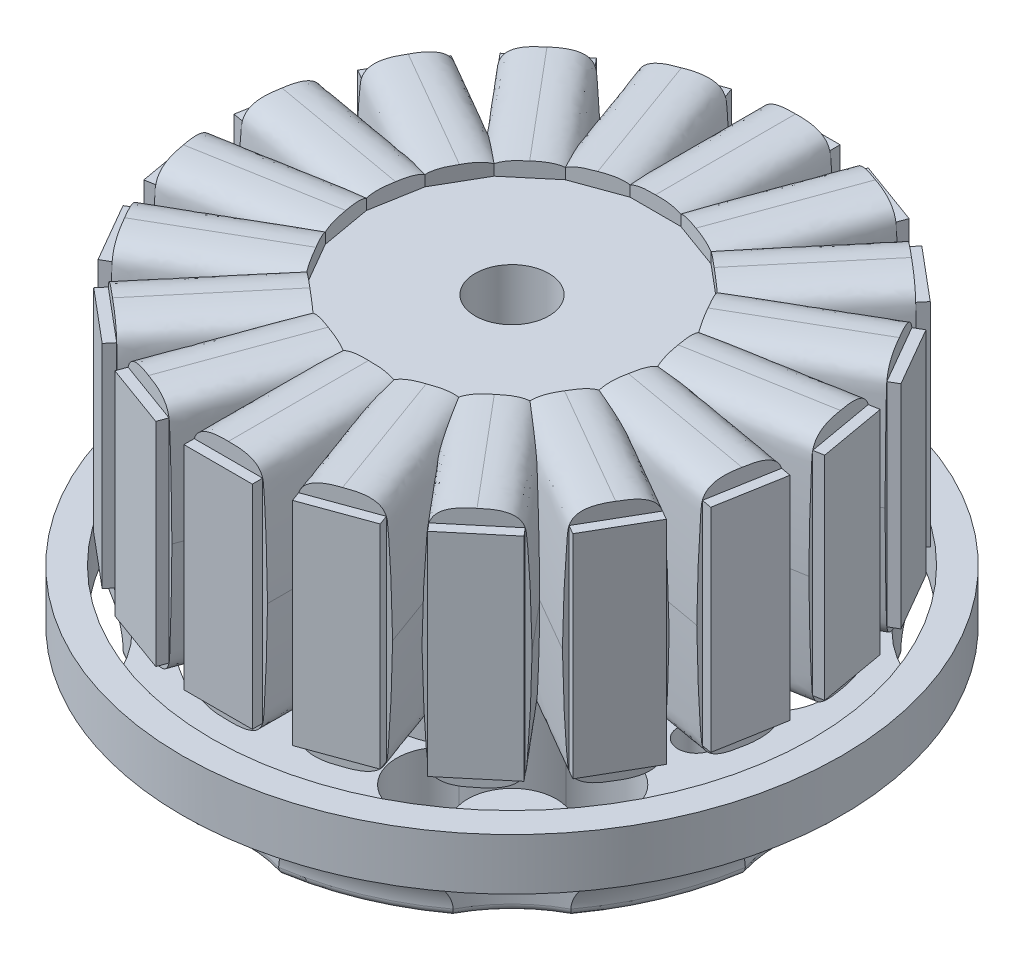
from build123d import *

# Parameters (mm, degrees)
SKETCH1_R           = 22.36
BOSS_EXTRUDE1_DEPTH = 7.5
SKETCH4_R           = 3.5
SKETCH6_R           = 20.36
CUT_EXTRUDE3_DEPTH  = 3.9
SKETCH7_R           = 10
BOSS_EXTRUDE2_DEPTH = 20.8
BOSS_EXTRUDE3_START = -15.4
BOSS_EXTRUDE3_DEPTH = 15.4
CIRPATTERN1_COUNT   = 18
SKETCH10_R          = 24.373241
CUT_EXTRUDE4_DEPTH  = 1
SKETCH11_R          = 8
CUT_EXTRUDE5_DEPTH  = 0.2
SKETCH12_R          = 3.75
SKETCH12_R_2        = 2.5
BOSS_EXTRUDE4_DEPTH = 0.2
CUT_EXTRUDE6_START  = -41.2
SKETCH13_R          = 2.5
CUT_EXTRUDE6_DEPTH  = 41.2
SKETCH14_R          = 1.25
SKETCH14_R_2        = 1
SKETCH14_R_3        = 9.637923
CUT_EXTRUDE7_DEPTH  = 4
CUT_EXTRUDE8_DEPTH  = 10
BOSS_EXTRUDE5_DEPTH = 9.5
CIRPATTERN4_COUNT   = 18
FILLET2_R           = 0.5


with BuildPart() as part:
    # Sketch1 → Boss-Extrude1 (new body)
    with BuildSketch(Plane(origin=(0, 0, 0), x_dir=(1, 0, 0), z_dir=(0, 1, 0))):
        with Locations(Location((0, 0, 0), (0, 0, 270))):
            Circle(SKETCH1_R)
    extrude(amount=-BOSS_EXTRUDE1_DEPTH)

    # Sketch4 → Cut-Revolve1 (revolve, cut)
    with BuildSketch(Plane.XY, mode=Mode.PRIVATE) as cut_revolve1_sk:
        with Locations((-22.36, -7)):
            Circle(SKETCH4_R)
    revolve(cut_revolve1_sk.sketch.rotate(Axis((0, 0, 0), (0, -1, 0)), 270), axis=Axis((0, 0, 0), (0, -1, 0)), mode=Mode.SUBTRACT)

    # Sketch6 → Cut-Extrude3 (cut)
    with BuildSketch(Plane(origin=(0, 0, 0), x_dir=(1, 0, 0), z_dir=(0, 1, 0))):
        with Locations(Location((0, 0, 0), (0, 0, 270))):
            Circle(SKETCH6_R)
    extrude(amount=-CUT_EXTRUDE3_DEPTH, mode=Mode.SUBTRACT)

    # Sketch7 → Boss-Extrude2 (add)
    with BuildSketch(Plane(origin=(0, -3.9, 0), x_dir=(1, 0, 0), z_dir=(0, 1, 0))):
        with Locations(Location((0, 0, 0), (0, 0, 270))):
            Circle(SKETCH7_R)
    extrude(amount=BOSS_EXTRUDE2_DEPTH)

    # Sketch9 → Boss-Extrude3 (add)
    with BuildSketch(Plane(origin=(0, 16.9, 0), x_dir=(1, 0, 0), z_dir=(0, 1, 0)).offset(BOSS_EXTRUDE3_START)):
        with BuildLine():
            Line((2.32, 19.93), (-2.32, 19.93))
            Line((-2.32, 19.93), (-2.32, 19.23))
            Line((-2.32, 19.23), (-0.35, 19.23))
            Line((-0.35, 19.23), (-0.35, 9.993873))
            ThreePointArc((-0.35, 9.993873), (0, 10), (0.35, 9.993873))
            Line((0.35, 9.993873), (0.35, 19.23))
            Line((0.35, 19.23), (2.32, 19.23))
            Line((2.32, 19.23), (2.32, 19.93))
        make_face()
    boss_extrude3 = extrude(amount=BOSS_EXTRUDE3_DEPTH)

    # CirPattern1: Boss-Extrude3 ×18 about axis
    cirpattern1_axis = Axis((0, 0, 0), (0, 1, 0))
    for i in range(1, CIRPATTERN1_COUNT):
        add(boss_extrude3.rotate(cirpattern1_axis, i * 360 / CIRPATTERN1_COUNT))

    # Sketch10 → Cut-Extrude4 (cut)
    with BuildSketch(Plane(origin=(0, 16.9, 0), x_dir=(1, 0, 0), z_dir=(0, 1, 0))):
        Circle(SKETCH10_R)
    extrude(amount=-CUT_EXTRUDE4_DEPTH, mode=Mode.SUBTRACT)

    # Sketch11 → Cut-Extrude5 (cut)
    with BuildSketch(Plane.XZ.offset(7.5)):
        with Locations(Location((0, 0, 0), (0, 0, 270))):
            Circle(SKETCH11_R)
    extrude(amount=-CUT_EXTRUDE5_DEPTH, mode=Mode.SUBTRACT)

    # Sketch12 → Boss-Extrude4 (add)
    with BuildSketch(Plane(origin=(0, -7.3, 0), x_dir=(-1, 0, 0), z_dir=(0, -1, 0))):
        with Locations(Location((0, 0, 0), (0, 0, 90))):
            Circle(SKETCH12_R)
        with Locations(Location((0, 0, 0), (0, 0, 90))):
            Circle(SKETCH12_R_2, mode=Mode.SUBTRACT)
    extrude(amount=BOSS_EXTRUDE4_DEPTH)

    # Sketch13 → Cut-Extrude6 (cut)
    with BuildSketch(Plane.XZ.offset(7.3).offset(CUT_EXTRUDE6_START)):
        with Locations(Location((0, 0, 0), (0, 0, 90))):
            Circle(SKETCH13_R)
    extrude(amount=CUT_EXTRUDE6_DEPTH, mode=Mode.SUBTRACT)

    # Sketch14 → Cut-Extrude7 (cut)
    with BuildSketch(Plane(origin=(0, -7.5, 0), x_dir=(-1, 0, 0), z_dir=(0, -1, 0))):
        with Locations(Location((0, -12.5, 0), (0, 0, 90))):
            Circle(SKETCH14_R)
        with Locations(Location((-12.5, 0, 0), (0, 0, 90))):
            Circle(SKETCH14_R)
        with Locations(Location((0, 12.5, 0), (0, 0, 90))):
            Circle(SKETCH14_R)
        with Locations(Location((12.5, 0, 0), (0, 0, 90))):
            Circle(SKETCH14_R)
        with Locations(Location((-11.313708, -11.313708, 0), (0, 0, 90))):
            Circle(SKETCH14_R_2)
        with Locations(Location((-4.141105, 15.454813, 0), (0, 0, 90))):
            Circle(SKETCH14_R_2)
        with Locations(Location((15.454813, -4.141105, 0), (0, 0, 90))):
            Circle(SKETCH14_R_2)
        with Locations((-27.860964, 0)):
            Circle(SKETCH14_R_3)
        with Locations((-19.700677, 19.700677)):
            Circle(SKETCH14_R_3)
        with Locations((0, 27.860964)):
            Circle(SKETCH14_R_3)
        with Locations((19.700677, 19.700677)):
            Circle(SKETCH14_R_3)
        with Locations((27.860964, 0)):
            Circle(SKETCH14_R_3)
        with Locations((19.700677, -19.700677)):
            Circle(SKETCH14_R_3)
        with Locations((0, -27.860964)):
            Circle(SKETCH14_R_3)
        with Locations((-19.700677, -19.700677)):
            Circle(SKETCH14_R_3)
    extrude(amount=-CUT_EXTRUDE7_DEPTH, mode=Mode.SUBTRACT)

    # Sketch15 → Cut-Extrude8 (cut)
    with BuildSketch(Plane(origin=(0, -7.5, 0), x_dir=(-1, 0, 0), z_dir=(0, -1, 0))):
        with BuildLine():
            ThreePointArc((4.972418, -8.67612), (7.076548, -7.065583), (8.68382, -4.958958))
            ThreePointArc((8.68382, -4.958958), (9.526442, -4.005691), (10.67921, -3.467307))
            ThreePointArc((10.67921, -3.467307), (11.848094, -3.673803), (12.500935, -4.665131))
            ThreePointArc((12.500935, -4.665131), (12.87004, -5.663914), (13.564771, -6.470856))
            ThreePointArc((13.564771, -6.470856), (14.097477, -7.378195), (13.903115, -8.412247))
            ThreePointArc((13.903115, -8.412247), (11.353423, -11.625931), (8.080179, -14.098695))
            ThreePointArc((8.080179, -14.098695), (3.815011, -12.941288), (4.972418, -8.67612))
        make_face()
        with BuildLine():
            ThreePointArc((8.642891, 5.029953), (7.064429, 7.077701), (5.013722, 8.652317))
            ThreePointArc((5.013722, 8.652317), (3.876661, 12.922955), (8.147298, 14.060016))
            ThreePointArc((8.147298, 14.060016), (11.479696, 11.501264), (14.044698, 8.173674))
            ThreePointArc((14.044698, 8.173674), (12.915655, 3.90091), (8.642891, 5.029953))
        make_face()
        with BuildLine():
            ThreePointArc((-14.098695, 8.080179), (-11.625931, 11.353423), (-8.412247, 13.903115))
            ThreePointArc((-8.412247, 13.903115), (-7.378195, 14.097477), (-6.470856, 13.564771))
            ThreePointArc((-6.470856, 13.564771), (-5.663914, 12.87004), (-4.665131, 12.500935))
            ThreePointArc((-4.665131, 12.500935), (-3.673803, 11.848094), (-3.467307, 10.67921))
            ThreePointArc((-3.467307, 10.67921), (-4.005691, 9.526442), (-4.958958, 8.68382))
            ThreePointArc((-4.958958, 8.68382), (-7.065583, 7.076548), (-8.67612, 4.972418))
            ThreePointArc((-8.67612, 4.972418), (-12.941288, 3.815011), (-14.098695, 8.080179))
        make_face()
        with BuildLine():
            ThreePointArc((-8.657087, -5.005481), (-12.662037, -3.727752), (-14.315166, -7.592902))
            ThreePointArc((-14.315166, -7.592902), (-13.535048, -8.459695), (-12.369804, -8.505744))
            ThreePointArc((-12.369804, -8.505744), (-9.195784, -9.188998), (-8.502381, -12.360817))
            ThreePointArc((-8.502381, -12.360817), (-8.440185, -13.551523), (-7.529126, -14.320693))
            ThreePointArc((-7.529126, -14.320693), (-3.763404, -12.576613), (-5.050113, -8.631127))
            ThreePointArc((-5.050113, -8.631127), (-7.089299, -7.05279), (-8.657087, -5.005481))
        make_face()
    extrude(amount=-CUT_EXTRUDE8_DEPTH, mode=Mode.SUBTRACT)

    # Sketch16 → Boss-Extrude5 (add)
    with BuildSketch(Plane(origin=(16.653669, 0, -9.615), x_dir=(0.4999999999999983, 0, 0.8660254037844396), z_dir=(-0.8660254037844396, 0, 0.4999999999999983))):
        with BuildLine():
            add(Edge.make_bspline(
                [(0, 16.9), (-1.57476, 16.945327), (-2.343222, 16.244448), (-2.514108, 13.777336), (-2.630528, 11.074315), (-2.65, 8.7)],
                knots=[0, 0, 0, 0, 0.099934, 0.155486, 0.555519, 0.555519, 0.555519, 0.555519], degree=3))
            add(Edge.make_bspline(
                [(0, 0.5), (-1.57476, 0.454673), (-2.343222, 1.155552), (-2.514108, 3.622664), (-2.630528, 6.325685), (-2.65, 8.7)],
                knots=[0, 0, 0, 0, 0.099934, 0.155486, 0.555519, 0.555519, 0.555519, 0.555519], degree=3))
            add(Edge.make_bspline(
                [(0, 0.5), (1.57476, 0.454673), (2.343222, 1.155552), (2.514108, 3.622664), (2.630528, 6.325685), (2.65, 8.7)],
                knots=[0, 0, 0, 0, 0.099934, 0.155486, 0.555519, 0.555519, 0.555519, 0.555519], degree=3))
            add(Edge.make_bspline(
                [(0, 16.9), (1.57476, 16.945327), (2.343222, 16.244448), (2.514108, 13.777336), (2.630528, 11.074315), (2.65, 8.7)],
                knots=[0, 0, 0, 0, 0.099934, 0.155486, 0.555519, 0.555519, 0.555519, 0.555519], degree=3))
        make_face()
    boss_extrude5 = extrude(amount=BOSS_EXTRUDE5_DEPTH)

    # CirPattern4: Boss-Extrude5 ×18 about axis
    cirpattern4_axis = Axis((0, 16.9, 0), (0, -1, 0))
    for i in range(1, CIRPATTERN4_COUNT):
        add(boss_extrude5.rotate(cirpattern4_axis, i * 360 / CIRPATTERN4_COUNT))

    # Fillet2
    # the kernel refuses this fillet: 0.5 mm, written as the material it takes off along each edge
    with BuildSketch(Plane(origin=(-19.700677, -7.5, 19.700677), x_dir=(0.34244794361491465, 0, -0.9395368039166514), z_dir=(-0.9395368039166514, 0, -0.34244794361491465))) as fillet2_piece_1:
        with BuildLine():
            CenterArc((9.637923 + FILLET2_R, -FILLET2_R), FILLET2_R, 90, 90)
            Line((9.637923, -FILLET2_R), (9.637923, 0))
            Line((9.637923, 0), (9.637923 + FILLET2_R, 0))
        make_face()
    revolve(axis=Axis((-19.700677, -7.5, 19.700677), (0, -1, 0)), revolution_arc=49.947827, mode=Mode.SUBTRACT)
    with BuildSketch(Plane(origin=(0, -7.5, 27.860964), x_dir=(-0.422205582090242, 0, -0.9065001083573239), z_dir=(-0.9065001083573239, 0, 0.422205582090242))) as fillet2_piece_2:
        with BuildLine():
            CenterArc((9.637923 + FILLET2_R, -FILLET2_R), FILLET2_R, 90, 90)
            Line((9.637923, -FILLET2_R), (9.637923, 0))
            Line((9.637923, 0), (9.637923 + FILLET2_R, 0))
        make_face()
    revolve(axis=Axis((0, -7.5, 27.860964), (0, -1, 0)), revolution_arc=49.947827, mode=Mode.SUBTRACT)
    with BuildSketch(Plane(origin=(19.700677, -7.5, 19.700677), x_dir=(-0.9395368039166537, 0, -0.3424479436149085), z_dir=(-0.3424479436149085, 0, 0.9395368039166537))) as fillet2_piece_3:
        with BuildLine():
            CenterArc((9.637923 + FILLET2_R, -FILLET2_R), FILLET2_R, 90, 90)
            Line((9.637923 + FILLET2_R, 0), (9.637923, 0))
            Line((9.637923, 0), (9.637923, -FILLET2_R))
        make_face()
    revolve(axis=Axis((19.700677, -7.5, 19.700677), (0, -1, 0)), revolution_arc=49.947827, mode=Mode.SUBTRACT)
    with BuildSketch(Plane(origin=(27.860964, -7.5, 0), x_dir=(-0.906500108357323, -1.290163677716629e-15, 0.42220558209024395), z_dir=(0.42220558209024395, -2.7715594162080037e-15, 0.906500108357323))) as fillet2_piece_4:
        with BuildLine():
            CenterArc((9.637923 + FILLET2_R, -FILLET2_R), FILLET2_R, 90, 90)
            Line((9.637923, -FILLET2_R), (9.637923, 0))
            Line((9.637923, 0), (9.637923 + FILLET2_R, 0))
        make_face()
    revolve(axis=Axis((27.860964, -7.5, 0), (0, -1, 0)), revolution_arc=49.947827, mode=Mode.SUBTRACT)
    with BuildSketch(Plane(origin=(19.700677, -7.5, -19.700677), x_dir=(-0.3424479436149205, 0, 0.9395368039166492), z_dir=(0.9395368039166492, 0, 0.3424479436149205))) as fillet2_piece_5:
        with BuildLine():
            CenterArc((9.637923 + FILLET2_R, -FILLET2_R), FILLET2_R, 90, 90)
            Line((9.637923, -FILLET2_R), (9.637923, 0))
            Line((9.637923, 0), (9.637923 + FILLET2_R, 0))
        make_face()
    revolve(axis=Axis((19.700677, -7.5, -19.700677), (0, -1, 0)), revolution_arc=49.947827, mode=Mode.SUBTRACT)
    with BuildSketch(Plane(origin=(0, -7.5, -27.860964), x_dir=(0.42220558209022635, 0, 0.9065001083573312), z_dir=(0.9065001083573312, 0, -0.42220558209022635))) as fillet2_piece_6:
        with BuildLine():
            CenterArc((9.637923 + FILLET2_R, -FILLET2_R), FILLET2_R, 90, 90)
            Line((9.637923, -FILLET2_R), (9.637923, 0))
            Line((9.637923, 0), (9.637923 + FILLET2_R, 0))
        make_face()
    revolve(axis=Axis((0, -7.5, -27.860964), (0, -1, 0)), revolution_arc=49.947827, mode=Mode.SUBTRACT)
    with BuildSketch(Plane(origin=(-19.700677, -7.5, -19.700677), x_dir=(0.9395368039166487, 0, 0.34244794361492215), z_dir=(0.34244794361492215, 0, -0.9395368039166487))) as fillet2_piece_7:
        with BuildLine():
            CenterArc((9.637923 + FILLET2_R, -FILLET2_R), FILLET2_R, 90, 90)
            Line((9.637923, -FILLET2_R), (9.637923, 0))
            Line((9.637923, 0), (9.637923 + FILLET2_R, 0))
        make_face()
    revolve(axis=Axis((-19.700677, -7.5, -19.700677), (0, -1, 0)), revolution_arc=49.947827, mode=Mode.SUBTRACT)
    with BuildSketch(Plane(origin=(-27.860964, -7.5, 0), x_dir=(0.906500108357328, 0, -0.4222055820902331), z_dir=(-0.4222055820902331, 0, -0.906500108357328))) as fillet2_piece_8:
        with BuildLine():
            CenterArc((9.637923 + FILLET2_R, -FILLET2_R), FILLET2_R, 90, 90)
            Line((9.637923, -FILLET2_R), (9.637923, 0))
            Line((9.637923, 0), (9.637923 + FILLET2_R, 0))
        make_face()
    revolve(axis=Axis((-27.860964, -7.5, 0), (0, -1, 0)), revolution_arc=49.947827, mode=Mode.SUBTRACT)
    with BuildSketch(Plane(origin=(0, -7.5, 0), x_dir=(-0.7635820486055227, 0, 0.6457108137915867), z_dir=(0.6457108137915867, 0, 0.7635820486055227))) as fillet2_piece_9:
        with BuildLine():
            CenterArc((18.36, -0.5), FILLET2_R, 0, 90)
            ThreePointArc((18.86, -0.5), (18.868986, -0.249356), (18.895898, 0))
            Line((18.895898, 0), (18.36, 0))
        make_face()
    revolve(axis=Axis((0, -7.5, 0), (0, -1, 0)), revolution_arc=35.437982, mode=Mode.SUBTRACT)
    with BuildSketch(Plane(origin=(0, -7.5, 0), x_dir=(-0.9965205396787992, 0, -0.08334754944372878), z_dir=(-0.08334754944372878, 0, 0.9965205396787992))) as fillet2_piece_10:
        with BuildLine():
            CenterArc((18.36, -0.5), FILLET2_R, 0, 90)
            ThreePointArc((18.86, -0.5), (18.868986, -0.249356), (18.895898, 0))
            Line((18.895898, 0), (18.36, 0))
        make_face()
    revolve(axis=Axis((0, -7.5, 0), (0, -1, 0)), revolution_arc=35.437982, mode=Mode.SUBTRACT)
    with BuildSketch(Plane(origin=(0, -7.5, 0), x_dir=(-0.6457108137915848, 0, -0.7635820486055244), z_dir=(-0.7635820486055244, 0, 0.6457108137915848))) as fillet2_piece_11:
        with BuildLine():
            CenterArc((18.36, -0.5), FILLET2_R, 0, 90)
            ThreePointArc((18.86, -0.5), (18.868986, -0.249356), (18.895898, 0))
            Line((18.895898, 0), (18.36, 0))
        make_face()
    revolve(axis=Axis((0, -7.5, 0), (0, -1, 0)), revolution_arc=35.437982, mode=Mode.SUBTRACT)
    with BuildSketch(Plane(origin=(0, -7.5, 0), x_dir=(0.08334754944373005, 0, -0.9965205396787992), z_dir=(-0.9965205396787992, 0, -0.08334754944373005))) as fillet2_piece_12:
        with BuildLine():
            CenterArc((18.36, -0.5), FILLET2_R, 0, 90)
            ThreePointArc((18.86, -0.5), (18.868986, -0.249356), (18.895898, 0))
            Line((18.895898, 0), (18.36, 0))
        make_face()
    revolve(axis=Axis((0, -7.5, 0), (0, -1, 0)), revolution_arc=35.437982, mode=Mode.SUBTRACT)
    with BuildSketch(Plane(origin=(0, -7.5, 0), x_dir=(0.7635820486055277, 0, -0.6457108137915807), z_dir=(-0.6457108137915807, 0, -0.7635820486055277))) as fillet2_piece_13:
        with BuildLine():
            CenterArc((18.36, -0.5), FILLET2_R, 0, 90)
            ThreePointArc((18.86, -0.5), (18.868986, -0.249356), (18.895898, 0))
            Line((18.895898, 0), (18.36, 0))
        make_face()
    revolve(axis=Axis((0, -7.5, 0), (0, -1, 0)), revolution_arc=35.437982, mode=Mode.SUBTRACT)
    with BuildSketch(Plane(origin=(0, -7.5, 0), x_dir=(0.9965205396787978, 0, 0.08334754944374549), z_dir=(0.08334754944374549, 0, -0.9965205396787978))) as fillet2_piece_14:
        with BuildLine():
            CenterArc((18.36, -0.5), FILLET2_R, 0, 90)
            ThreePointArc((18.86, -0.5), (18.868986, -0.249356), (18.895898, 0))
            Line((18.895898, 0), (18.36, 0))
        make_face()
    revolve(axis=Axis((0, -7.5, 0), (0, -1, 0)), revolution_arc=35.437982, mode=Mode.SUBTRACT)
    with BuildSketch(Plane(origin=(0, -7.5, 0), x_dir=(-0.08334754944372716, 0, 0.9965205396787993), z_dir=(0.9965205396787993, 0, 0.08334754944372716))) as fillet2_piece_15:
        with BuildLine():
            CenterArc((18.36, -0.5), FILLET2_R, 0, 90)
            ThreePointArc((18.86, -0.5), (18.868986, -0.249356), (18.895898, 0))
            Line((18.895898, 0), (18.36, 0))
        make_face()
    revolve(axis=Axis((0, -7.5, 0), (0, -1, 0)), revolution_arc=35.437982, mode=Mode.SUBTRACT)
    with BuildSketch(Plane(origin=(0, -7.5, 0), x_dir=(0.6457108137915875, 0, 0.7635820486055219), z_dir=(0.7635820486055219, 0, -0.6457108137915875))) as fillet2_piece_16:
        with BuildLine():
            CenterArc((18.36, -0.5), FILLET2_R, 0, 90)
            ThreePointArc((18.86, -0.5), (18.868986, -0.249356), (18.895898, 0))
            Line((18.895898, 0), (18.36, 0))
        make_face()
    revolve(axis=Axis((0, -7.5, 0), (0, -1, 0)), revolution_arc=35.437982, mode=Mode.SUBTRACT)


solid = part.part
